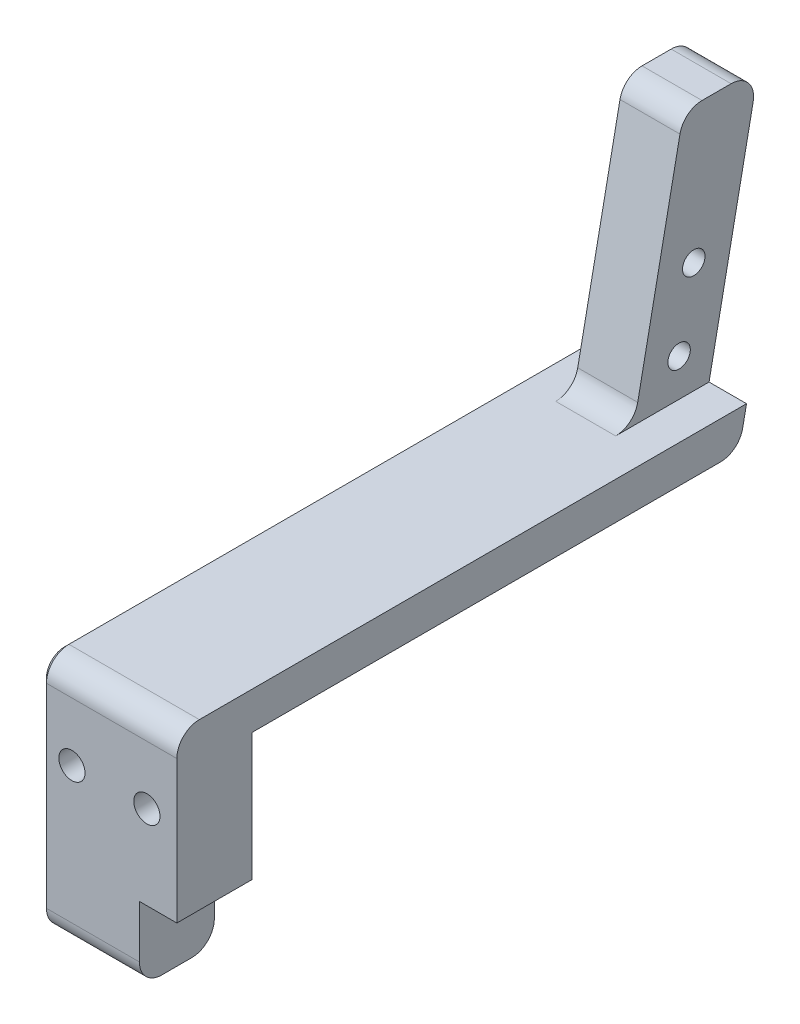
from build123d import *

# Parameters (mm, degrees)
EXTRUDE_1_DEPTH     = 9
CUT_EXTRUDE_1_DEPTH = 5
SKETCH_3_R          = 1.75
CUT_EXTRUDE_2_DEPTH = 50.647599136312735
SKETCH_4_W          = 3.000000000000001
SKETCH_4_H          = 19.851507449534697
EXTRUDE_2_DEPTH     = 5.5
FILLET_2_R          = 5
FILLET_3_R          = 5
SKETCH_6_W          = 18
SKETCH_6_H          = 10.000000000000004
EXTRUDE_3_DEPTH     = 16.2
CUT_EXTRUDE_5_DEPTH = 52.567649463300064
CUT_EXTRUDE_6_DEPTH = 53.49411618001278
EXTRUDE_4_DEPTH     = 18
SKETCH_11_W         = 4.999999999999995
SKETCH_11_H         = 18.60004044786868
CUT_EXTRUDE_7_DEPTH = 33
SKETCH_12_R         = 1.4999999999999973
CUT_EXTRUDE_8_DEPTH = 90.33116605445798
FILLET_4_R          = 3
CHAMFER_3_SIZE      = 0.6


# Some blends are built 0.0001 mm under size
with BuildPart() as part:
    # ｽｹｯﾁ1 → ﾎﾞｽ - 押し出し1 (new, symmetric)
    with BuildSketch(Plane(origin=(0, 0, 0), x_dir=(0, 0, -1), z_dir=(1, 0, 0))):
        Polygon((-5.0000000000000036, -6.499999999999999), (5.0000000000000036, -6.499999999999999), (5.0000000000000036, 6.499999999999999), (13.25805060886326, 47.79), (3.2580506088632593, 47.79), (-5.0000000000000036, 6.500000000000001), align=None)
    extrude(amount=EXTRUDE_1_DEPTH, both=True)

    # ｽｹｯﾁ2 → ｶｯﾄ - 押し出し1 (cut)
    with BuildSketch(Plane(origin=(9, 0, 0), x_dir=(0, 0, -1), z_dir=(1, 0, 0))):
        Polygon((3.2580506088632593, 47.790000000000006), (-1.10677614066039, 25.966000000000005), (8.50860394182422, 24.04291219799919), (13.258050608863256, 47.790000000000006), align=None)
    cut_extrude_1 = extrude(amount=-CUT_EXTRUDE_1_DEPTH, mode=Mode.SUBTRACT)

    # ﾐﾗｰ1: ｶｯﾄ - 押し出し1 across plane
    add(cut_extrude_1.mirror(Plane(origin=(0, 0, 0), x_dir=(0, 0, 1), z_dir=(1, 0, 0))), mode=Mode.SUBTRACT)

    # ｽｹｯﾁ3 → ｶｯﾄ - 押し出し2 (cut, through all)
    with BuildSketch(Plane(origin=(0, 0, -5.0000000000000036), x_dir=(-1, 0, 0), z_dir=(0, 0, -1))):
        with Locations((5, -1.4999999999999987)):
            Circle(SKETCH_3_R)
        with Locations((-5, -1.4999999999999987)):
            Circle(SKETCH_3_R)
    extrude(amount=-CUT_EXTRUDE_2_DEPTH, mode=Mode.SUBTRACT)

    # ｽｹｯﾁ4 → ﾎﾞｽ - 押し出し2 (add)
    with BuildSketch(Plane(origin=(0, 1.2115468473854123, 6.057697112542844), x_dir=(1, 0, 0), z_dir=(0, 0.19611729080206414, 0.980580444557436))):
        with Locations((7.5, 15.318940160380402)):
            Rectangle(SKETCH_4_W, SKETCH_4_H)
        Polygon((-8.99999999999999, 5.393186435613051), (-8.999999999999993, 25.24469388514775), (-5.999999999999994, 25.244693885147754), (-5.9999999999999885, 5.393186435613052), align=None)
    extrude(amount=EXTRUDE_2_DEPTH)

    # ﾌｨﾚｯﾄ2
    # the kernel refuses this fillet: 5 mm, written as the material it takes off along each edge
    with BuildSketch(Plane(origin=(-19.247567109880233, 47.79, -13.25805060886326), x_dir=(0, -0.9805804445574373, 0.19611729080205748), z_dir=(1, 0, 0))) as fillet_2_piece_1:
        with BuildLine():
            CenterArc((FILLET_2_R * 1.21980536879, -FILLET_2_R), FILLET_2_R, 90.00000000000003, 101.30999999999938)
            Line((FILLET_2_R * 0.239224924233, -FILLET_2_R * 1.1961172908), (0, 0))
            Line((0, 0), (FILLET_2_R * 1.21980536879, 2e-17))
        make_face()
    extrude(amount=38.495134219760466, mode=Mode.SUBTRACT)
    with BuildSketch(Plane(origin=(14.247536467555662, 47.79, -3.2580506088632593), x_dir=(0, 0, -1), z_dir=(-1, 0, 0))) as fillet_2_piece_2:
        with BuildLine():
            CenterArc((FILLET_2_R * 0.819802917404, FILLET_2_R), FILLET_2_R, 191.30999999999946, 78.69000000000051)
            Line((-FILLET_2_R * 0.160777527153, FILLET_2_R * 0.803882709198), (0, 0))
            Line((0, 0), (FILLET_2_R * 0.819802917404, 0))
        make_face()
    extrude(amount=28.495072935111324, mode=Mode.SUBTRACT)

    # ﾌｨﾚｯﾄ3
    fillet_3_edges = [part.edges().sort_by_distance(p)[0] for p in [
        (-4, 25.004456098999597, -3.7009139005819147),
        (4, 25.004456098999597, -3.7009139005819147),
    ]]
    fillet(fillet_3_edges, radius=FILLET_3_R - 0.0001)  # a hair under: the kernel refuses the full size

    # 面取り2
    # the kernel refuses this chamfer: 1 mm, written as the material it takes off along each edge
    with BuildSketch(Plane(origin=(9, 23.43957972269821, -11.525247830932894), x_dir=(-0.9850292351397439, 0.16903968557305887, -0.0338081443053687), z_dir=(0, 0.19611729080206025, 0.9805804445574368))) as chamfer_2_piece_1:
        with BuildLine():
            Line((1.2305543745450382, 1e-17), (-0.4179125111005865, 1.157416606835036))
            Line((-0.4179125111005865, 1.157416606835036), (-0.5656668963715484, 1.1315585010807419))
            ThreePointArc((-0.5656668963715484, 1.1315585010807419), (-0.2522325130461084, 0.5711346395907222), (-0.14775438527096194, -0.02585810575429407))
            Line((-0.14775438527096194, -0.02585810575429407), (0.02585810575429378, -0.14775438527096027))
            ThreePointArc((0.02585810575429378, -0.14775438527096027), (0.6228508510993123, -0.04327625749581342), (1.2564124802993322, -0.14775438527096027))
            Line((1.2564124802993322, -0.14775438527096027), (1.2305543745450382, 1e-17))
        make_face()
    extrude(amount=21.458576318299393, mode=Mode.SUBTRACT)

    # ｽｹｯﾁ6 → ﾎﾞｽ - 押し出し3 (add)
    with BuildSketch(Plane.XZ.offset(6.499999999999999)):
        Rectangle(SKETCH_6_W, SKETCH_6_H)
    extrude(amount=EXTRUDE_3_DEPTH)

    # ｽｹｯﾁ7 → ｶｯﾄ - 押し出し5 (cut, through all)
    with BuildSketch(Plane.XY.offset(5.0000000000000036)):
        Polygon((9, -22.7), (3.9999999999999982, -22.7), (3.9999999999999982, -12.700000000000001), (9, -12.7), align=None)
    extrude(amount=-CUT_EXTRUDE_5_DEPTH, mode=Mode.SUBTRACT)

    # ｽｹｯﾁ8 → ｶｯﾄ - 押し出し6 (cut, through all)
    with BuildSketch(Plane(origin=(9, 0, 0), x_dir=(0, 0, -1), z_dir=(1, 0, 0))):
        Polygon((-14.730367070472871, 56.5), (-14.730367070472871, 6.499999999999999), (-5.0000000000000036, 6.499999999999999), (-10.393192445065868, 7.578645099411347), (-6.696085876528205, 26.064064654853848), (8.31248665102216, 23.062331753441747), (5.0000000000000036, 6.499999999999999), (15.269632929527129, 6.499999999999999), (15.269632929527127, 56.5), align=None)
        Polygon((-10.393192445065868, 7.578645099411347), (-5.0000000000000036, 6.500000000000001), (5.000000000000002, 6.499999999999999), (8.31248665102216, 23.062331753441747), (-6.696085876528205, 26.064064654853848), align=None)
    extrude(amount=-CUT_EXTRUDE_6_DEPTH, mode=Mode.SUBTRACT)

    # ｽｹｯﾁ10 → ﾎﾞｽ - 押し出し4 (add)
    with BuildSketch(Plane(origin=(9, 0, 0), x_dir=(0, 0, -1), z_dir=(1, 0, 0))):
        Polygon((61.000006128464946, 9.300000000000002), (-5.0000000000000036, 9.300000000000002), (-5.0000000000000036, 6.499999999999999), (5.000000000000002, 6.499999999999999), (5.0000000000000036, 4.299999999999994), (69.99999999999999, 4.300000000000002), (77.60004657633361, 42.300000000000004), (67.60004657633361, 42.3), align=None)
    extrude(amount=-EXTRUDE_4_DEPTH)

    # ｽｹｯﾁ11 → ｶｯﾄ - 押し出し7 (cut)
    with BuildSketch(Plane(origin=(0, 42.29999999999995, 2.935e-14), x_dir=(1, 0, 0), z_dir=(0, 1, 0))):
        with Locations((-6.499999999999997, 68.30002635239924)):
            Rectangle(SKETCH_11_W, SKETCH_11_H)
        Polygon((4, 77.60004657633358), (4, 59.0000061284649), (8.999999999999995, 59.0000061284649), (9, 77.60004657633358), align=None)
    extrude(amount=-CUT_EXTRUDE_7_DEPTH, mode=Mode.SUBTRACT)

    # ｽｹｯﾁ12 → ｶｯﾄ - 押し出し8 (cut, through all)
    with BuildSketch(Plane(origin=(4, 0, 0), x_dir=(-5e-17, 0, -1), z_dir=(1, 0, -5e-17))):
        with Locations((68.96118516495055, 24.105804445574364)):
            Circle(SKETCH_12_R)
        with Locations((67.00001225692989, 14.300000000000004)):
            Circle(SKETCH_12_R)
    extrude(amount=-CUT_EXTRUDE_8_DEPTH, mode=Mode.SUBTRACT)

    # ﾌｨﾚｯﾄ4
    fillet_4_edges = [part.edges().sort_by_distance(p)[0] for p in [
        (-2.500000000000001, -22.7, -5.000000000000002),
        (-2.5, -22.7, 5.000000000000002),
        (0, 9.300000000000002, 5.0000000000000036),
        (0, 4.3000000000000025, -69.99999999999999),
        (0, 42.300000000000004, -77.60004657633361),
        (0, 42.3, -67.60004657633361),
        (0, 9.300000000000002, -61.000006128464946),
    ]]
    fillet(fillet_4_edges, radius=FILLET_4_R)

    # 面取り3
    chamfer_3_edges = [part.edges().sort_by_distance(p)[0] for p in [
        (-8.999999999999998, 9.299999999999974, -34.50000306423246),
        (-9, 4.299999999999998, -36.27029562389333),
        (-9, -22.7, 0),
        (-9, 8.005824063796883, -70.74116935496194),
        (-9, -7.700000000000004, -5.000000000000003),
        (-9, -6.699999999999992, 5.000000000000003),
        (-9, 8.421320343559644, 4.1213203435596455),
        (-9, 4.979972455204619, -69.4425565974686),
        (-9, -21.821320343559645, -4.1213203435596455),
        (-9, -21.82132034355964, 4.1213203435596455),
    ]]
    chamfer(chamfer_3_edges, length=CHAMFER_3_SIZE)


solid = part.part
